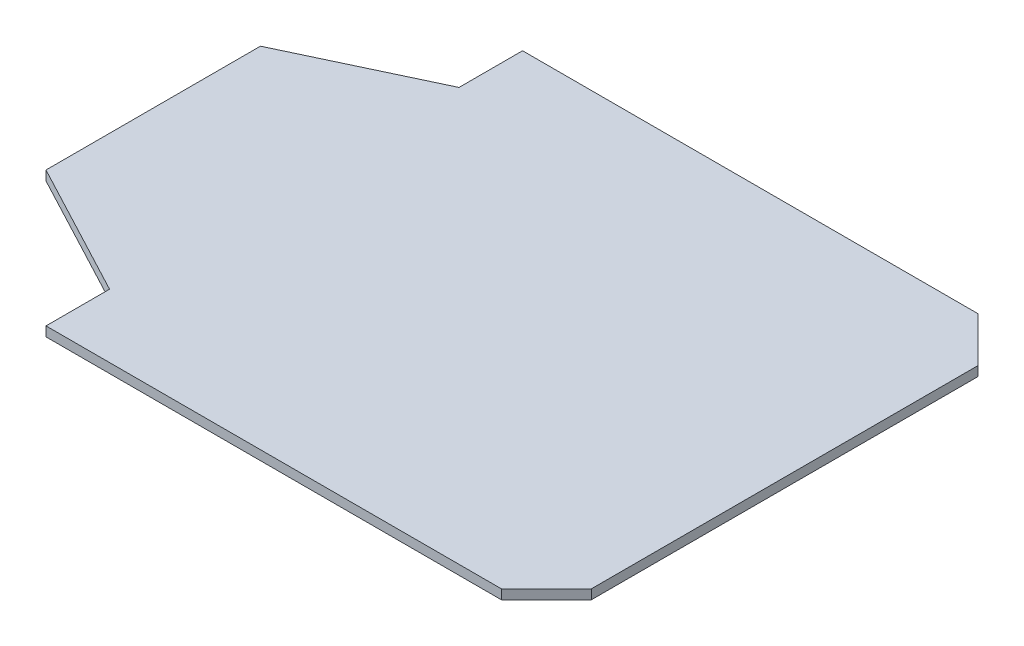
from build123d import *

# Parameters (mm, degrees)
BOSS_EXTRUDE1_DEPTH = 6
CUT_EXTRUDE1_DEPTH  = 10


with BuildPart() as part:
    # Sketch1 → Boss-Extrude1 (new body)
    with BuildSketch(Plane(origin=(0, 0, 0), x_dir=(1, 0, 0), z_dir=(0, 1, 0))):
        Polygon((-245.183632637, 942.323086709), (-245.183632637, 742.323086709), (-245.183632637, 692.323086709), (-145.183632637, 692.323086709), (126.532096115, 692.323086709), (154.816367363, 720.607357957), (154.816367363, 964.038815462), (126.532096115, 992.323086709), (-145.183632637, 992.323086709), (-245.183632637, 992.323086709), align=None)
    extrude(amount=BOSS_EXTRUDE1_DEPTH)

    # Sketch2 → Cut-Extrude1 (cut)
    with BuildSketch(Plane(origin=(0, 6, 0), x_dir=(1, 0, 0), z_dir=(0, 1, 0))):
        Polygon((-245.183632637, 912.323086709), (-160.183632637, 952.323086709), (-160.183632637, 992.323086709), (-245.183632637, 992.323086709), align=None)
        Polygon((-245.183632637, 777.323086709), (-160.183632637, 732.323086709), (-160.183632637, 692.323086709), (-245.183632637, 692.323086709), align=None)
    extrude(amount=-CUT_EXTRUDE1_DEPTH, mode=Mode.SUBTRACT)


solid = part.part
